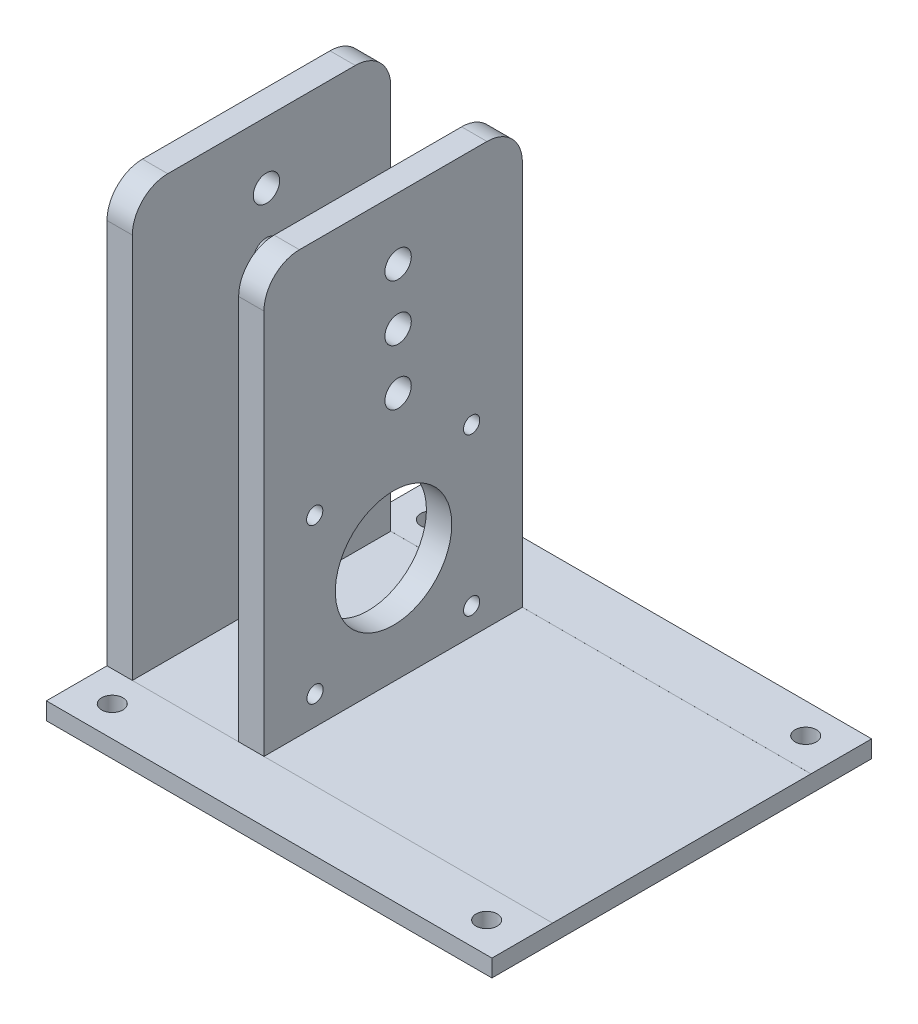
from build123d import *

# Parameters (mm, degrees)
SKETCH1_W                = 88.006134304
SKETCH1_H                = 51.04430696
BOSS_EXTRUDE1_DEPTH      = 3.406110275
SKETCH2_W                = 5
SKETCH2_H                = 51.04430696
BOSS_EXTRUDE3_DEPTH      = 83.180869555
SKETCH8_R                = 11.5
CUT_EXTRUDE3_DEPTH       = 107.763218116
SKETCH9_R                = 1.6
CUT_EXTRUDE4_DEPTH       = 107.763218116
SKETCH17_W               = 51.04430696
SKETCH17_H               = 86.58697983
BOSS_EXTRUDE4_DEPTH      = 5
SKETCH20_R               = 2.605
CUT_EXTRUDE6_DEPTH       = 107.763218116
FILLET2_R                = 7
FILLET4_R                = 7
FILLET5_R                = 7
FILLET6_R                = 7
SKETCH21_R               = 2.6
CUT_EXTRUDE7_DEPTH       = 107.763218116
SKETCH27_W               = 88.006134304
SKETCH27_H               = 11.97784652
BOSS_EXTRUDE7_DEPTH      = 3.41
CUT_EXTRUDE10_DEPTH      = 102.299442144
CUT_EXTRUDE10_DEPTH_BACK = 102.299442144
SKETCH28_R               = 2.1
BOSS_EXTRUDE8_DEPTH      = 22


with BuildPart() as part:
    # Sketch1 → Boss-Extrude1 (new body)
    with BuildSketch(Plane(origin=(0, 0, 0), x_dir=(1, 0, 0), z_dir=(0, 1, 0))):
        Rectangle(SKETCH1_W, SKETCH1_H)
    extrude(amount=BOSS_EXTRUDE1_DEPTH)

    # Sketch2 → Boss-Extrude3 (add)
    with BuildSketch(Plane(origin=(0, 3.406110275, 0), x_dir=(1, 0, 0), z_dir=(0, 1, 0))):
        with Locations((-15.503067152, 0)):
            Rectangle(SKETCH2_W, SKETCH2_H)
    extrude(amount=BOSS_EXTRUDE3_DEPTH)

    # Sketch8 → Cut-Extrude3 (cut, through all)
    with BuildSketch(Plane(origin=(-13.003067152, 0, 0), x_dir=(0, 0, -1), z_dir=(1, 0, 0))):
        with Locations((0.071404436, 24.556110275)):
            Circle(SKETCH8_R)
    extrude(amount=-CUT_EXTRUDE3_DEPTH, mode=Mode.SUBTRACT)

    # Sketch9 → Cut-Extrude4 (cut, through all)
    with BuildSketch(Plane(origin=(-13.003067152, 0, 0), x_dir=(0, 0, -1), z_dir=(1, 0, 0))):
        with Locations((-15.428595564, 9.056110275)):
            Circle(SKETCH9_R)
        with Locations((-15.49999857, 39.65)):
            Circle(SKETCH9_R)
        with Locations((15.49999857, 39.65)):
            Circle(SKETCH9_R)
        with Locations((15.49999857, 8.65)):
            Circle(SKETCH9_R)
    extrude(amount=-CUT_EXTRUDE4_DEPTH, mode=Mode.SUBTRACT)

    # Sketch17 → Boss-Extrude4 (add)
    with BuildSketch(Plane(origin=(-44.003067152, -0.060669127, 0), x_dir=(0, 0, 1), z_dir=(-1, 0, 0))):
        with Locations((0, 43.354159042)):
            Rectangle(SKETCH17_W, SKETCH17_H)
    extrude(amount=-BOSS_EXTRUDE4_DEPTH)

    # Sketch20 → Cut-Extrude6 (cut, through all)
    with BuildSketch(Plane(origin=(-13.003067152, 0, 0), x_dir=(0, 0, -1), z_dir=(1, 0, 0))):
        with Locations((0.974230033, 74.372828985)):
            Circle(SKETCH20_R)
        with Locations((0.974230033, 63.29872192)):
            Circle(SKETCH20_R)
    extrude(amount=-CUT_EXTRUDE6_DEPTH, mode=Mode.SUBTRACT)

    # Fillet2
    fillet2_edges = [part.edges().sort_by_distance(p)[0] for p in [
        (-15.503067152, 86.586979829, 25.52215348),
    ]]
    fillet(fillet2_edges, radius=FILLET2_R)

    # Fillet4
    fillet4_edges = [part.edges().sort_by_distance(p)[0] for p in [
        (-41.503067152, 86.586979829, 25.52215348),
    ]]
    fillet(fillet4_edges, radius=FILLET4_R)

    # Fillet5
    fillet5_edges = [part.edges().sort_by_distance(p)[0] for p in [
        (-15.503067152, 86.586979829, -25.52215348),
    ]]
    fillet(fillet5_edges, radius=FILLET5_R)

    # Fillet6
    fillet6_edges = [part.edges().sort_by_distance(p)[0] for p in [
        (-41.503067152, 86.586979829, -25.52215348),
    ]]
    fillet(fillet6_edges, radius=FILLET6_R)

    # Sketch21 → Cut-Extrude7 (cut, through all)
    with BuildSketch(Plane(origin=(-13.003067152, 0, 0), x_dir=(0, 0, -1), z_dir=(1, 0, 0))):
        with Locations((0.974230033, 52.29872192)):
            Circle(SKETCH21_R)
    extrude(amount=-CUT_EXTRUDE7_DEPTH, mode=Mode.SUBTRACT)

    # Sketch27 → Boss-Extrude7 (add)
    with BuildSketch(Plane.XZ):
        with Locations((0, -31.51107674)):
            Rectangle(SKETCH27_W, SKETCH27_H)
        with Locations((0, 31.51107674)):
            Rectangle(SKETCH27_W, SKETCH27_H)
    extrude(amount=-BOSS_EXTRUDE7_DEPTH)

    # Sketch28 → Cut-Extrude10 (cut, two sides: drawn at the far end of the back side and taken through both)
    with BuildSketch(Plane(origin=(0, 3.406110275, 0), x_dir=(1, 0, 0), z_dir=(0, 1, 0)).offset(-CUT_EXTRUDE10_DEPTH_BACK)):
        with Locations((36.975574022, 31.51107674)):
            Circle(SKETCH28_R)
        with Locations((-36.975574022, 31.51107674)):
            Circle(SKETCH28_R)
        with Locations((-36.975574022, -31.51107674)):
            Circle(SKETCH28_R)
        with Locations((36.975574022, -31.51107674)):
            Circle(SKETCH28_R)
    extrude(amount=CUT_EXTRUDE10_DEPTH + CUT_EXTRUDE10_DEPTH_BACK, mode=Mode.SUBTRACT)

    # Sketch29 → Boss-Extrude8 (add)
    with BuildSketch(Plane(origin=(-39.003067152, 0, 0), x_dir=(0, 0, -1), z_dir=(1, 0, 0))):
        Polygon((0.974230033, 44.159669274), (-4.025769967, 44.159669274), (-4.025769967, 47.159669274), (5.974230033, 47.159669274), (5.974230033, 44.159669274), align=None)
    extrude(amount=BOSS_EXTRUDE8_DEPTH)


solid = part.part
